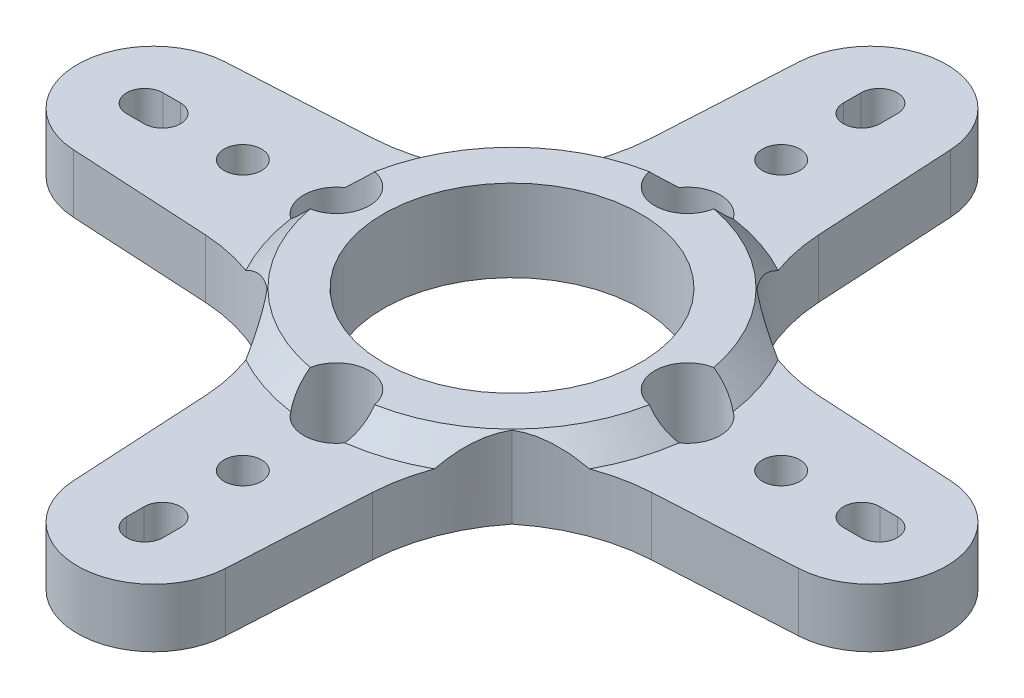
from build123d import *

# Parameters (mm, degrees)
SKETCH1_R           = 14.75
SKETCH1_R_2         = 11
BOSS_EXTRUDE1_DEPTH = 7
SKETCH5_R           = 6.5
BOSS_EXTRUDE3_DEPTH = 5
FILLET2_R           = 15
CIRPATTERN2_DEPTH   = 5
CHAMFER2_SIZE       = 2
CUT_EXTRUDE3_REACH  = 54.74
CIRPATTERN4_COUNT   = 4
CUT_EXTRUDE4_REACH  = 54.967
SKETCH9_R           = 2.8
CIRPATTERN5_COUNT   = 4
CUT_EXTRUDE5_REACH  = 54.74
SKETCH10_R          = 1.6
CIRPATTERN6_COUNT   = 4


# Read off the part's stored shape, not the designer's step: CirPattern2
with BuildPart() as part:
    # Sketch1 → Boss-Extrude1 (new body)
    with BuildSketch(Plane(origin=(0, 0, 0), x_dir=(1, 0, 0), z_dir=(0, 1, 0))):
        with Locations(Location((0, 0, 0), (0, 0, 270))):
            Circle(SKETCH1_R)
        with Locations(Location((0, 0, 0), (0, 0, 270))):
            Circle(SKETCH1_R_2, mode=Mode.SUBTRACT)
    extrude(amount=BOSS_EXTRUDE1_DEPTH)

    # Sketch5 → Boss-Extrude3 (add)
    with BuildSketch(Plane.XZ):
        with BuildLine():
            ThreePointArc((6.5, 30.625), (-0.17931828, 24.127473936), (-6.49010614, 30.983500062))
            Line((-6.49010614, 30.983500062), (-7.5, 12.700885796))
            ThreePointArc((-7.5, 12.700885796), (0, 14.75), (7.5, 12.700885796))
            Line((7.5, 12.700885796), (6.49010614, 30.983500062))
            ThreePointArc((6.49010614, 30.983500062), (6.497526064, 30.80431828), (6.5, 30.625))
        make_face()
        with Locations((0, 30.625)):
            Circle(SKETCH5_R)
    extrude(amount=-BOSS_EXTRUDE3_DEPTH)

    # Fillet2
    fillet2_edges = [part.edges().sort_by_distance(p)[0] for p in [
        (7.5, 2.5, 12.700885796),
        (-7.5, 2.5, 12.700885796),
    ]]
    fillet(fillet2_edges, radius=FILLET2_R)

    # CirPattern2 outline → CirPattern2 (add)
    with BuildSketch(Plane(origin=(0, 0, 0), x_dir=(1, 0, 0), z_dir=(0, 1, 0))):
        with BuildLine():
            Line((-30.983500062, -6.49010614), (-19.060050189, -7.14873289))
            ThreePointArc((-19.060050189, -7.14873289), (-14.499104834, -8.127089257), (-10.459249152, -10.459249152))
            ThreePointArc((-10.459249152, -10.459249152), (-10.710685451, -10.156332582), (-10.969984482, -9.860118684))
            ThreePointArc((-10.969984482, -9.860118684), (0, 14.75), (10.969984482, -9.860118684))
            ThreePointArc((10.969984482, -9.860118684), (10.710685451, -10.156332582), (10.459249152, -10.459249152))
            ThreePointArc((10.459249152, -10.459249152), (14.499104834, -8.127089257), (19.060050189, -7.14873289))
            Line((19.060050189, -7.14873289), (30.983500062, -6.49010614))
            ThreePointArc((30.983500062, -6.49010614), (37.125, 0), (30.983500062, 6.49010614))
            Line((30.983500062, 6.49010614), (19.060050189, 7.14873289))
            ThreePointArc((19.060050189, 7.14873289), (14.499104834, 8.127089257), (10.459249152, 10.459249152))
            ThreePointArc((10.459249152, 10.459249152), (8.127089257, 14.499104834), (7.14873289, 19.060050189))
            Line((7.14873289, 19.060050189), (6.49010614, 30.983500062))
            ThreePointArc((6.49010614, 30.983500062), (0, 37.125), (-6.49010614, 30.983500062))
            Line((-6.49010614, 30.983500062), (-7.14873289, 19.060050189))
            ThreePointArc((-7.14873289, 19.060050189), (-8.127089257, 14.499104834), (-10.459249152, 10.459249152))
            ThreePointArc((-10.459249152, 10.459249152), (-14.499104834, 8.127089257), (-19.060050189, 7.14873289))
            Line((-19.060050189, 7.14873289), (-30.983500062, 6.49010614))
            ThreePointArc((-30.983500062, 6.49010614), (-37.125, 0), (-30.983500062, -6.49010614))
        make_face()
    extrude(amount=CIRPATTERN2_DEPTH)

    # Chamfer2
    # the kernel refuses this chamfer: 2 mm, written as the material it adds along each edge
    with BuildSketch(Plane(origin=(0, 5, 0), x_dir=(-0.7437277614936905, 0, 0.6684826226489246), z_dir=(0.6684826226489246, 0, 0.7437277614936905))) as chamfer2_piece_1_section:
        Polygon((14.75, -CHAMFER2_SIZE), (14.75 + CHAMFER2_SIZE, 0), (14.75, 0), align=None)
    chamfer2_piece_1 = revolve(axis=Axis((0, 5, 0), (0, -1, 0)), revolution_arc=263.900121289, mode=Mode.PRIVATE)
    chamfer2_piece_1 = chamfer2_piece_1 - Plane(origin=(-19.887358028, 5.976556714, 22.125900918), x_dir=(0.055153855863411774, 0, -0.998477867648251), z_dir=(0, -1, 0)) * Cylinder(15.000000014, 67, mode=Mode.PRIVATE)
    chamfer2_piece_1 = chamfer2_piece_1 - Plane(origin=(19.887358028, 5.976556714, 22.125900918), x_dir=(-0.62854059114179, 0, -0.7777767837156939), z_dir=(0, -1, 0)) * Cylinder(15.000000014, 67, mode=Mode.PRIVATE)
    chamfer2_piece_1 = chamfer2_piece_1 - Plane(origin=(22.125900918, 5.976556714, -19.887358028), x_dir=(-0.7777767837156939, 0, 0.62854059114179), z_dir=(0, -1, 0)) * Cylinder(15.000000014, 67, mode=Mode.PRIVATE)
    chamfer2_piece_1 = chamfer2_piece_1 - Plane(origin=(-19.887358028, 5.976556714, -22.125900918), x_dir=(0.62854059114179, 0, 0.7777767837156939), z_dir=(0, -1, 0)) * Cylinder(15.000000014, 67, mode=Mode.PRIVATE)
    add(chamfer2_piece_1)
    with BuildSketch(Plane(origin=(0, 5, 0), x_dir=(-0.7437277614936905, 0, 0.6684826226489246), z_dir=(0.6684826226489246, 0, 0.7437277614936905))) as chamfer2_piece_2_section:
        Polygon((14.75, -CHAMFER2_SIZE), (14.75 + CHAMFER2_SIZE, 0), (14.75, 0), align=None)
    chamfer2_piece_2 = revolve(axis=Axis((0, 5, 0), (0, -1, 0)), revolution_arc=263.900121289, mode=Mode.PRIVATE)
    chamfer2_piece_2 = chamfer2_piece_2 - Plane(origin=(-19.887358028, 5.654995073, 22.125900918), x_dir=(0.055153855863411774, 0, -0.998477867648251), z_dir=(0, -1, 0)) * Cylinder(15.000000014, 67, mode=Mode.PRIVATE)
    chamfer2_piece_2 = chamfer2_piece_2 - Plane(origin=(19.887358028, 5.654995073, 22.125900918), x_dir=(-0.62854059114179, 0, -0.7777767837156939), z_dir=(0, -1, 0)) * Cylinder(15.000000014, 67, mode=Mode.PRIVATE)
    chamfer2_piece_2 = chamfer2_piece_2 - Plane(origin=(19.887358028, 5.654995073, -22.125900918), x_dir=(-0.055153855863411774, 0, 0.998477867648251), z_dir=(0, -1, 0)) * Cylinder(15.000000014, 67, mode=Mode.PRIVATE)
    chamfer2_piece_2 = chamfer2_piece_2 - Plane(origin=(-22.125900918, 5.654995073, -19.887358028), x_dir=(0.998477867648251, 0, 0.055153855863411774), z_dir=(0, -1, 0)) * Cylinder(15.000000014, 67, mode=Mode.PRIVATE)
    add(chamfer2_piece_2)
    with BuildSketch(Plane(origin=(0, 5, 0), x_dir=(0, 0, 1), z_dir=(-1, 0, 0))) as chamfer2_piece_3_section:
        Polygon((14.75, CHAMFER2_SIZE), (14.75 + CHAMFER2_SIZE, 0), (14.75, 0), align=None)
    chamfer2_piece_3 = revolve(axis=Axis((0, 5, 0), (0, 1, 0)), revolution_arc=48.049939357, mode=Mode.PRIVATE)
    chamfer2_piece_3 = chamfer2_piece_3 - Plane(origin=(22.125900905, 5.691339401, 19.887358023), x_dir=(-0.7437277615096491, 0, -0.6684826226311694), z_dir=(0, 1, 0)) * Cylinder(15, 68, mode=Mode.PRIVATE)
    add(chamfer2_piece_3)
    with BuildSketch(Plane(origin=(0, 5, 0), x_dir=(0, 0, 1), z_dir=(-1, 0, 0))) as chamfer2_piece_4_section:
        Polygon((14.75, CHAMFER2_SIZE), (14.75 + CHAMFER2_SIZE, 0), (14.75, 0), align=None)
    chamfer2_piece_4 = revolve(axis=Axis((0, 5, 0), (0, 1, 0)), revolution_arc=48.049939357, mode=Mode.PRIVATE)
    chamfer2_piece_4 = chamfer2_piece_4 - Plane(origin=(19.887358028, 5.96883772, 22.125900918), x_dir=(-0.62854059114179, 0, -0.7777767837156939), z_dir=(0, -1, 0)) * Cylinder(15.000000014, 68, mode=Mode.PRIVATE)
    add(chamfer2_piece_4)
    with BuildSketch(Plane(origin=(0, 5, 0), x_dir=(-0.743727761509649, 0, 0.6684826226311695), z_dir=(-0.6684826226311695, 0, -0.743727761509649))) as chamfer2_piece_5_section:
        Polygon((14.75, CHAMFER2_SIZE), (14.75 + CHAMFER2_SIZE, 0), (14.75, 0), align=None)
    chamfer2_piece_5 = revolve(axis=Axis((0, 5, 0), (0, 1, 0)), revolution_arc=48.049939357, mode=Mode.PRIVATE)
    chamfer2_piece_5 = chamfer2_piece_5 - Plane(origin=(-22.125900905, 5.99378233, 19.887358023), x_dir=(0.7437277615096493, 0, -0.6684826226311694), z_dir=(0, 1, 0)) * Cylinder(15, 67, mode=Mode.PRIVATE)
    add(chamfer2_piece_5)
    with BuildSketch(Plane(origin=(0, 5, 0), x_dir=(-0.743727761509649, 0, 0.6684826226311695), z_dir=(-0.6684826226311695, 0, -0.743727761509649))) as chamfer2_piece_6_section:
        Polygon((14.75, CHAMFER2_SIZE), (14.75 + CHAMFER2_SIZE, 0), (14.75, 0), align=None)
    chamfer2_piece_6 = revolve(axis=Axis((0, 5, 0), (0, 1, 0)), revolution_arc=48.049939357, mode=Mode.PRIVATE)
    chamfer2_piece_6 = chamfer2_piece_6 - Plane(origin=(-19.887358028, 5.968837515, 22.125900918), x_dir=(0.055153855863411774, 0, -0.998477867648251), z_dir=(0, -1, 0)) * Cylinder(15.000000014, 67, mode=Mode.PRIVATE)
    add(chamfer2_piece_6)

    # Sketch8 → Cut-Extrude3 (cut, up to next)
    with BuildSketch(Plane(origin=(0, 5, 0), x_dir=(1, 0, 0), z_dir=(0, 1, 0)), mode=Mode.PRIVATE) as cut_extrude3_sk1:
        with BuildLine():
            Line((-1.55, 29.875), (-1.55, 31.375))
            ThreePointArc((-1.55, 31.375), (0, 32.925), (1.55, 31.375))
            Line((1.55, 31.375), (1.55, 29.875))
            ThreePointArc((1.55, 29.875), (0, 28.325), (-1.55, 29.875))
        make_face()
    cut_extrude3_tool1 = extrude(cut_extrude3_sk1.sketch, amount=-CUT_EXTRUDE3_REACH, mode=Mode.PRIVATE) & part.part
    cut_extrude3 = cut_extrude3_tool1.solids().sort_by_distance((0, 5, -30.625))[0]
    add(cut_extrude3, mode=Mode.SUBTRACT)

    # CirPattern4: Cut-Extrude3 ×4 about axis
    cirpattern4_axis = Axis((0, 0, 0), (0, 1, 0))
    for i in range(1, CIRPATTERN4_COUNT):
        add(cut_extrude3.rotate(cirpattern4_axis, i * 360 / CIRPATTERN4_COUNT), mode=Mode.SUBTRACT)

    # Sketch9 → Cut-Extrude4 (cut, up to next)
    with BuildSketch(Plane(origin=(0, 7, 0), x_dir=(1, 0, 0), z_dir=(0, 1, 0)), mode=Mode.PRIVATE) as cut_extrude4_sk1:
        with Locations(Location((0, 15, 0), (0, 0, 270))):
            Circle(SKETCH9_R)
    cut_extrude4_tool1 = extrude(cut_extrude4_sk1.sketch, amount=-CUT_EXTRUDE4_REACH, mode=Mode.PRIVATE) & part.part
    cut_extrude4 = cut_extrude4_tool1.solids().sort_by_distance((0, 7, -15))[0]
    add(cut_extrude4, mode=Mode.SUBTRACT)

    # CirPattern5: Cut-Extrude4 ×4 about axis
    cirpattern5_axis = Axis((0, 0, 0), (0, 1, 0))
    for i in range(1, CIRPATTERN5_COUNT):
        add(cut_extrude4.rotate(cirpattern5_axis, i * 360 / CIRPATTERN5_COUNT), mode=Mode.SUBTRACT)

    # Sketch10 → Cut-Extrude5 (cut, up to next)
    with BuildSketch(Plane(origin=(0, 5, 0), x_dir=(1, 0, 0), z_dir=(0, 1, 0)), mode=Mode.PRIVATE) as cut_extrude5_sk1:
        with Locations(Location((0, 23, 0), (0, 0, 270))):
            Circle(SKETCH10_R)
    cut_extrude5_tool1 = extrude(cut_extrude5_sk1.sketch, amount=-CUT_EXTRUDE5_REACH, mode=Mode.PRIVATE) & part.part
    cut_extrude5 = cut_extrude5_tool1.solids().sort_by_distance((0, 5, -23))[0]
    add(cut_extrude5, mode=Mode.SUBTRACT)

    # CirPattern6: Cut-Extrude5 ×4 about axis
    cirpattern6_axis = Axis((0, 0, 0), (0, 1, 0))
    for i in range(1, CIRPATTERN6_COUNT):
        add(cut_extrude5.rotate(cirpattern6_axis, i * 360 / CIRPATTERN6_COUNT), mode=Mode.SUBTRACT)


solid = part.part
